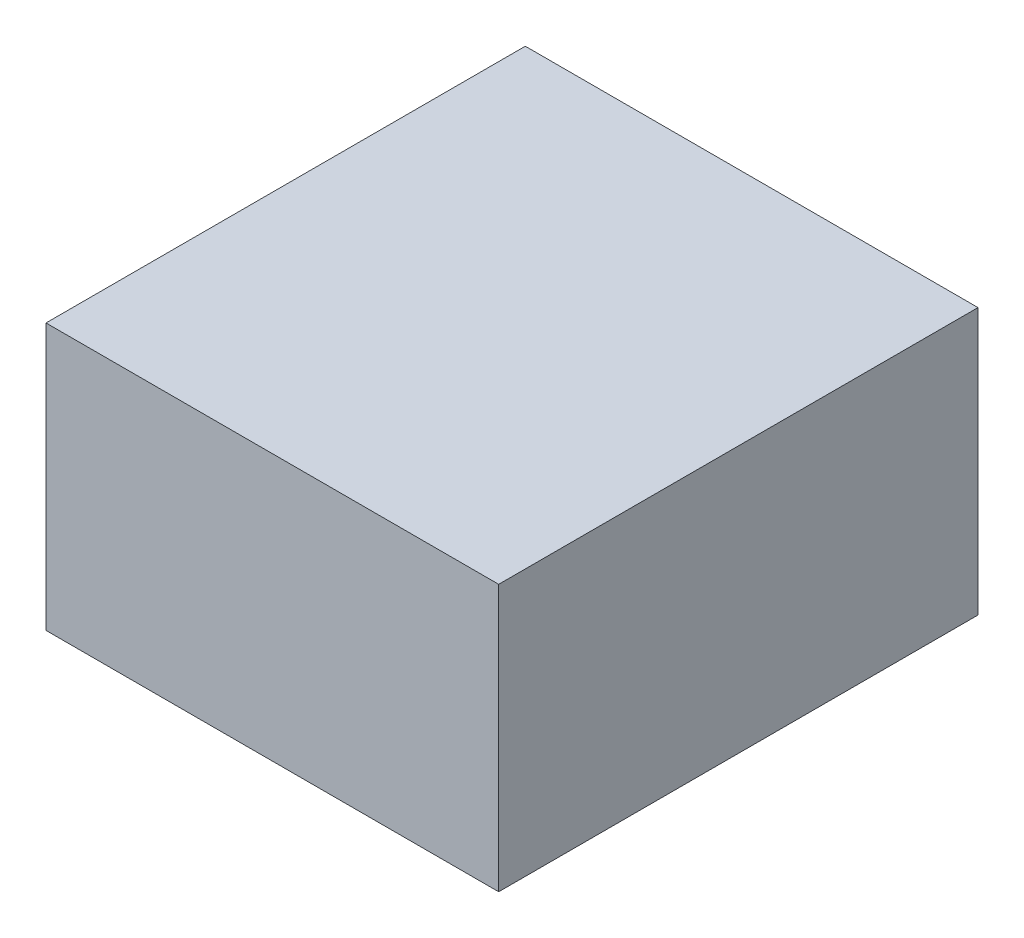
from build123d import *

# Parameters (mm, degrees)
SKETCH1_W           = 17
SKETCH1_H           = 18
BOSS_EXTRUDE1_DEPTH = 10


with BuildPart() as part:
    # Sketch1 → Boss-Extrude1 (new body)
    with BuildSketch(Plane(origin=(0, 0, 0), x_dir=(1, 0, 0), z_dir=(0, 1, 0))):
        with Locations((8.5, 9)):
            Rectangle(SKETCH1_W, SKETCH1_H)
    extrude(amount=BOSS_EXTRUDE1_DEPTH)


solid = part.part
